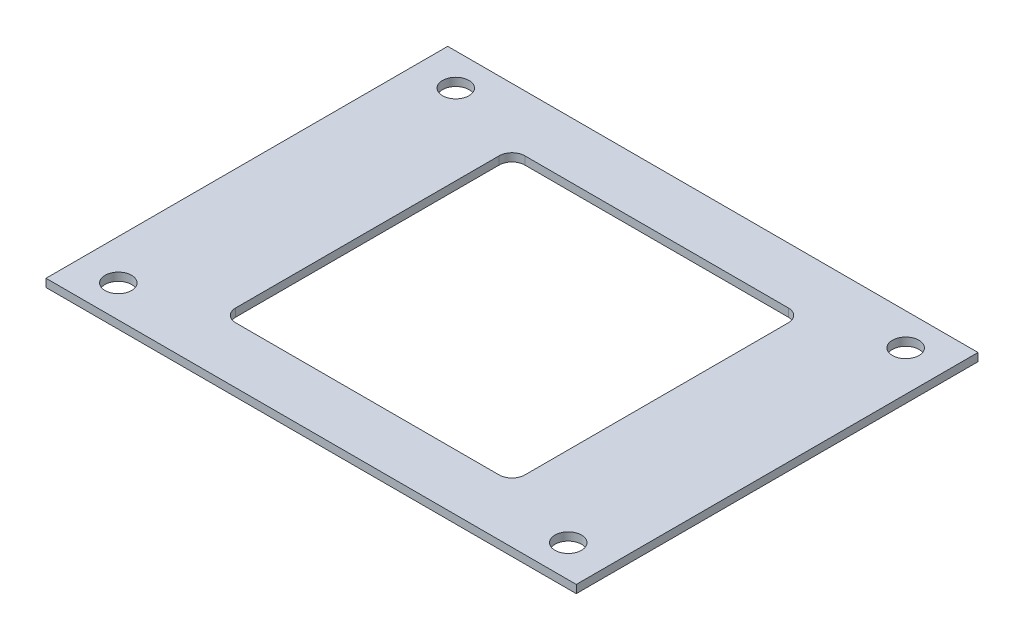
from build123d import *

# Parameters (mm, degrees)
SKETCH1_W           = 66
SKETCH1_H           = 50
SKETCH1_R           = 1.65
SKETCH1_W_2         = 36
SKETCH1_H_2         = 36
BOSS_EXTRUDE1_DEPTH = 1
FILLET1_R           = 1.6


with BuildPart() as part:
    # Sketch1 → Boss-Extrude1 (new body)
    with BuildSketch(Plane(origin=(0, 0, 0), x_dir=(1, 0, 0), z_dir=(0, 1, 0))):
        Rectangle(SKETCH1_W, SKETCH1_H)
        with Locations((-28, 21)):
            Circle(SKETCH1_R, mode=Mode.SUBTRACT)
        with Locations((-28, -21)):
            Circle(SKETCH1_R, mode=Mode.SUBTRACT)
        with Locations((28, 21)):
            Circle(SKETCH1_R, mode=Mode.SUBTRACT)
        with Locations((28, -21)):
            Circle(SKETCH1_R, mode=Mode.SUBTRACT)
        Rectangle(SKETCH1_W_2, SKETCH1_H_2, mode=Mode.SUBTRACT)
    extrude(amount=BOSS_EXTRUDE1_DEPTH)

    # Fillet1
    fillet1_edges = [part.edges().sort_by_distance(p)[0] for p in [
        (-18, 0.5, 18),
        (18, 0.5, 18),
        (18, 0.5, -18),
        (-18, 0.5, -18),
    ]]
    fillet(fillet1_edges, radius=FILLET1_R)


solid = part.part
